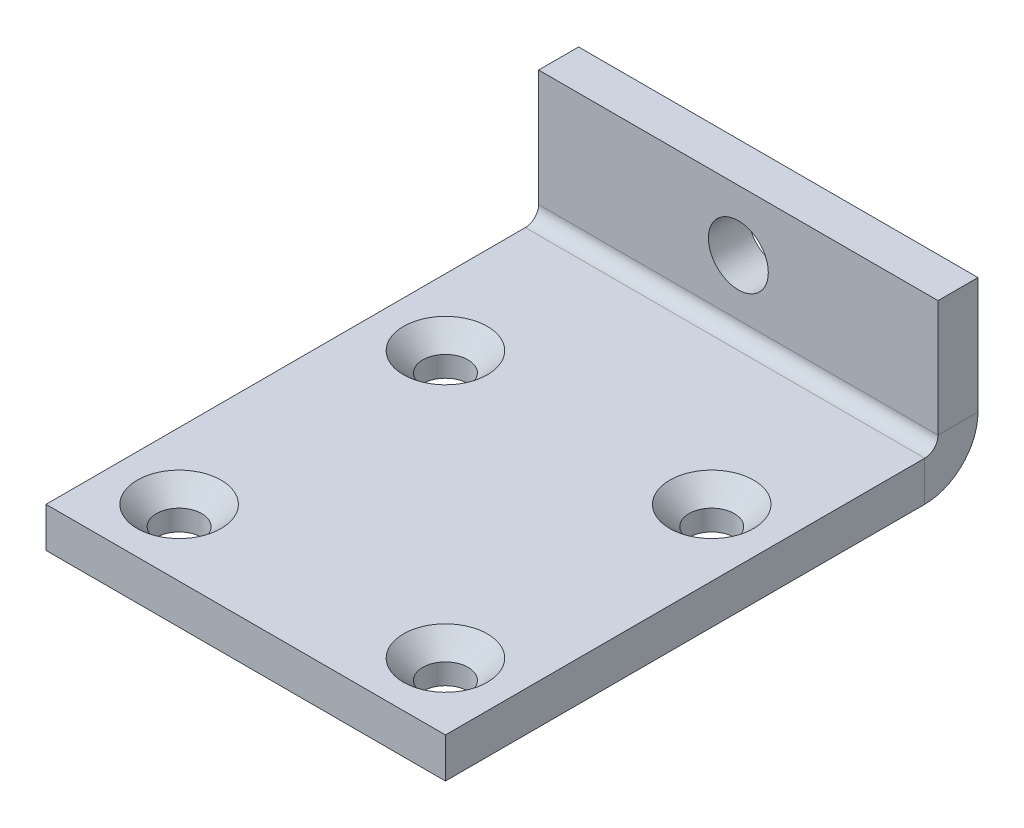
from build123d import *

# Parameters (mm, degrees)
T_LE_DE_BASE_PLI_E1_DEPTH                   = 30
FRAISAGE_POUR_VIS_T_TE_FRAIS_E_M31_AT_COUNT = 2
FRAISAGE_POUR_VIS_T_TE_FRAIS_E_M31_AT_PITCH = 20
FRAISAGE_POUR_VIS_T_TE_FRAIS_E_M31_2_COUNT  = 2
FRAISAGE_POUR_VIS_T_TE_FRAIS_E_M31_2_PITCH  = 28.284271247
FRAISAGE_POUR_VIS_T_TE_FRAIS_E_M31_3_COUNT  = 2
FRAISAGE_POUR_VIS_T_TE_FRAIS_E_M31_3_PITCH  = 20
D_GAGEMENT_M41_D                            = 4.5


# Sheet-metal steps are written as plain solids
with BuildPart() as part:
    # Esquisse1 → Tôle de base pliée1 (new body)
    with BuildSketch(Plane(origin=(0, 0, 0), x_dir=(0, 0, -1), z_dir=(1, 0, 0))):
        with BuildLine():
            Line((0, 12.75), (0, 4))
            ThreePointArc((0, 4), (-1.171572875, 1.171572875), (-4, 0))
            Line((-4, 0), (-40, 0))
            Line((-40, 0), (-40, 3))
            Line((-40, 3), (-4, 3))
            ThreePointArc((-4, 3), (-3.292893219, 3.292893219), (-3, 4))
            Line((-3, 4), (-3, 12.75))
            Line((-3, 12.75), (0, 12.75))
        make_face()
    extrude(amount=T_LE_DE_BASE_PLI_E1_DEPTH)

    # Esquisse7 → Fraisage pour vis à tête fraisée M31 (revolve, cut)
    with BuildSketch(Plane(origin=(5, 3, 35), x_dir=(0, 0, 1), z_dir=(1, 0, 0))):
        Polygon((0, 0), (0, 3), (1.7, 3), (1.7, 1.45), (3.15, 0), align=None)
    fraisage_pour_vis_t_te_frais_e_m31 = revolve(axis=Axis((5, 9.35, 35), (0, -1, 0)), mode=Mode.SUBTRACT)

    # Fraisage pour vis à tête fraisée M31 at: Fraisage pour vis à tête fraisée M31 ×2
    with Locations(*[(0, 0, -i * FRAISAGE_POUR_VIS_T_TE_FRAIS_E_M31_AT_PITCH) for i in range(1, FRAISAGE_POUR_VIS_T_TE_FRAIS_E_M31_AT_COUNT)]):
        add(fraisage_pour_vis_t_te_frais_e_m31, mode=Mode.SUBTRACT)

    # Fraisage pour vis _ t_te frais_e M31 2: Fraisage pour vis à tête fraisée M31 ×2
    with Locations(*[Vector(0.7071067811865476, 0, -0.7071067811865475) * (i * FRAISAGE_POUR_VIS_T_TE_FRAIS_E_M31_2_PITCH) for i in range(1, FRAISAGE_POUR_VIS_T_TE_FRAIS_E_M31_2_COUNT)]):
        add(fraisage_pour_vis_t_te_frais_e_m31, mode=Mode.SUBTRACT)

    # Fraisage pour vis _ t_te frais_e M31 3: Fraisage pour vis à tête fraisée M31 ×2
    with Locations(*[(i * FRAISAGE_POUR_VIS_T_TE_FRAIS_E_M31_3_PITCH, 0, 0) for i in range(1, FRAISAGE_POUR_VIS_T_TE_FRAIS_E_M31_3_COUNT)]):
        add(fraisage_pour_vis_t_te_frais_e_m31, mode=Mode.SUBTRACT)

    # Dégagement M41 (through all)
    with Locations(Plane.XY.offset(3)):
        with Locations((15, 8.2)):
            Hole(D_GAGEMENT_M41_D / 2)


solid = part.part
